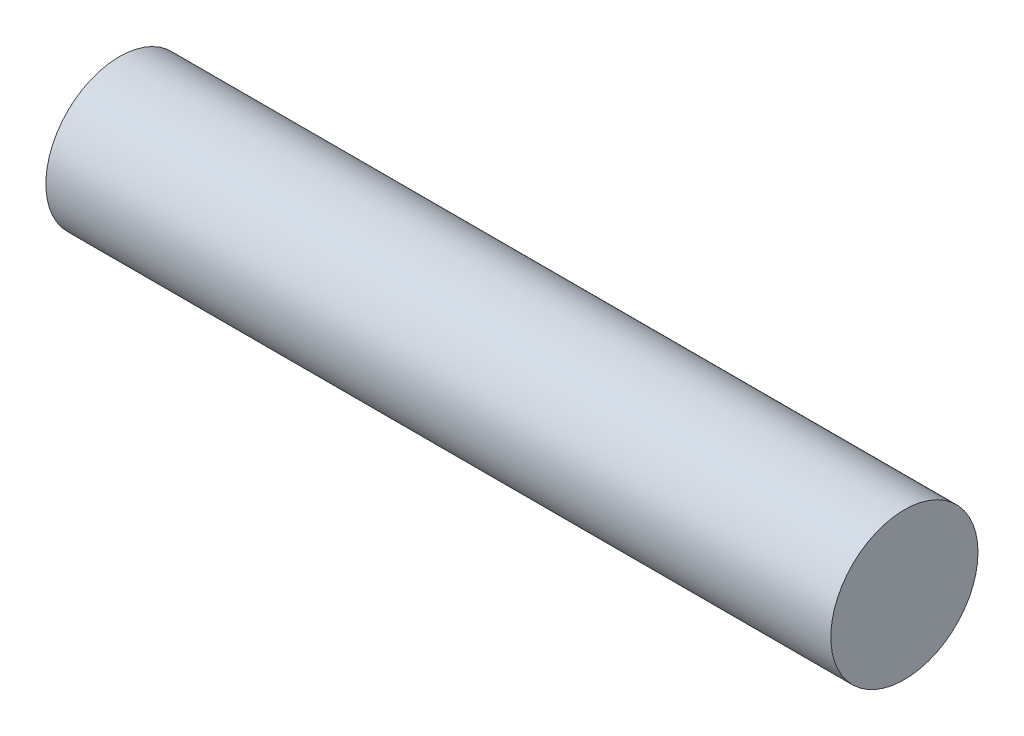
from build123d import *

# Parameters (mm, degrees)
SKETCH1_R           = 9.525
BOSS_EXTRUDE1_DEPTH = 101.6


with BuildPart() as part:
    # Sketch1 → Boss-Extrude1 (new body)
    with BuildSketch(Plane(origin=(0, 0, 0), x_dir=(0, 0, -1), z_dir=(1, 0, 0))):
        Circle(SKETCH1_R)
    extrude(amount=BOSS_EXTRUDE1_DEPTH)


solid = part.part
